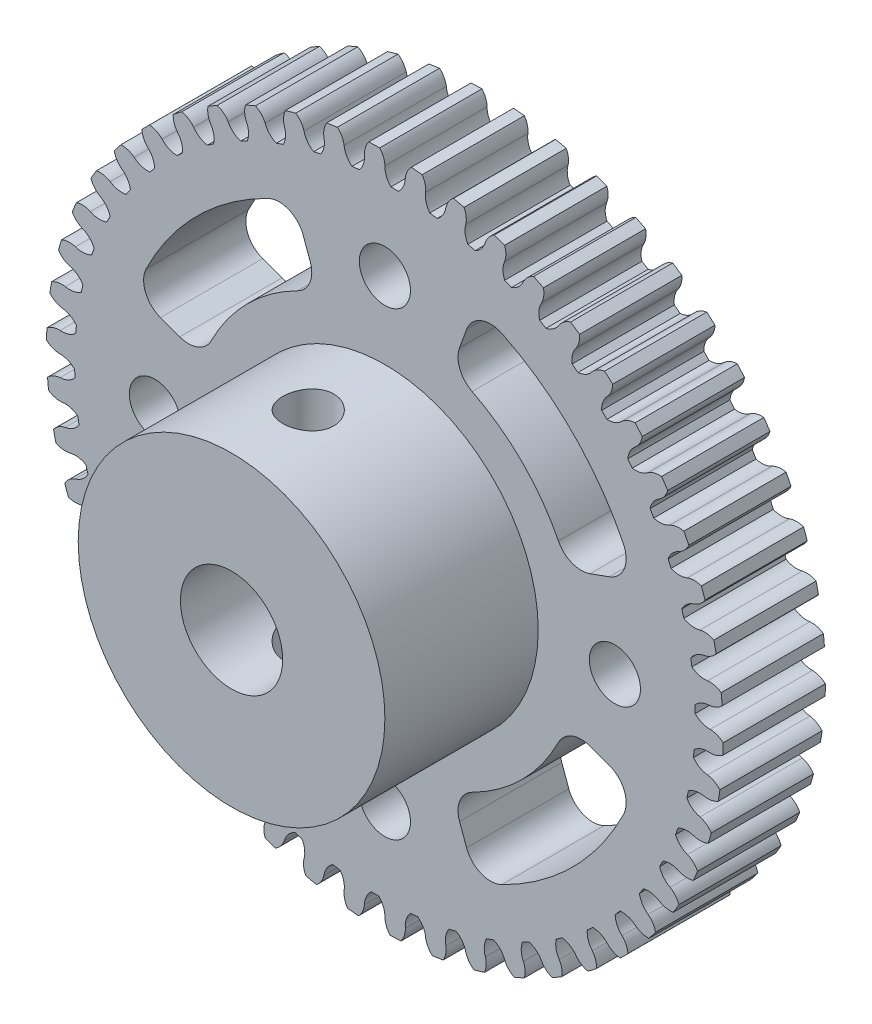
from build123d import *
from build123d.topology import SkipClean

# Parameters (mm, degrees)
SKETCH1_R               = 33.1
BOSS_EXTRUDE2_DEPTH     = 10
CUT_EXTRUDE1_START      = -18
CUT_EXTRUDE1_DEPTH      = 18
CIRPATTERN1_COUNT       = 50
SKETCH4_R               = 5
CUT_EXTRUDE2_DEPTH      = 78
SKETCH5_R               = 15
SKETCH5_R_2             = 5
BOSS_EXTRUDE3_DEPTH     = 15
SKETCH8_R               = 2.5
CUT_EXTRUDE3_DEPTH      = 40
CUT_EXTRUDE4_DEPTH      = 70
CUT_EXTRUDE4_DEPTH_BACK = 107
SKETCH11_R              = 2.5
CUT_EXTRUDE5_DEPTH      = 87


with BuildPart() as part:
    # Sketch1 → Boss-Extrude2 (new body)
    with BuildSketch(Plane.XY):
        Circle(SKETCH1_R)
    extrude(amount=BOSS_EXTRUDE2_DEPTH)

    # Sketch3 → Cut-Extrude1 (cut)
    with BuildSketch(Plane.XY.offset(10).offset(CUT_EXTRUDE1_START)):
        with BuildLine():
            ThreePointArc((1.999012735, 31.767166195), (2.182306526, 32.434344174), (2.5819624, 32.999143476))
            ThreePointArc((2.5819624, 32.999143476), (1.039899466, 33.083660757), (-0.50442729, 33.096156168))
            ThreePointArc((-0.50442729, 33.096156168), (-0.141031324, 32.507372301), (0, 31.83))
            ThreePointArc((0, 31.83), (0.141753405, 31.025150169), (0.593612137, 30.344194249))
            ThreePointArc((0.593612137, 30.344194249), (0.953502985, 30.335018247), (1.313259671, 30.321573987))
            ThreePointArc((1.313259671, 30.321573987), (1.806992344, 30.972807682), (1.999012735, 31.767166195))
        make_face()
    cut_extrude1 = extrude(amount=CUT_EXTRUDE1_DEPTH, mode=Mode.SUBTRACT)

    # CirPattern1: Cut-Extrude1 ×50 about axis
    cirpattern1_axis = Axis((0, 0, 10), (0, 0, 1))
    for i in range(1, CIRPATTERN1_COUNT):
        add(cut_extrude1.rotate(cirpattern1_axis, i * 360 / CIRPATTERN1_COUNT), mode=Mode.SUBTRACT)

    # Sketch4 → Cut-Extrude2 (cut)
    with BuildSketch(Plane(origin=(0, 0, 0), x_dir=(-1, 0, 0), z_dir=(0, 0, -1))):
        Circle(SKETCH4_R)
    extrude(amount=-CUT_EXTRUDE2_DEPTH, mode=Mode.SUBTRACT)

    # Sketch5 → Boss-Extrude3 (add)
    with SkipClean():  # the faces are left unmerged after this step: merging them gives an invalid solid
        with BuildSketch(Plane.XY.offset(10)):
            Circle(SKETCH5_R)
            Circle(SKETCH5_R_2, mode=Mode.SUBTRACT)
        extrude(amount=BOSS_EXTRUDE3_DEPTH)

    # Sketch8 → Cut-Extrude3 (cut)
    with SkipClean():  # the faces are left unmerged after this step: merging them gives an invalid solid
        with BuildSketch(Plane.XY.offset(10)):
            with Locations((-22.5, 0)):
                Circle(SKETCH8_R)
            with Locations((0, 22.5)):
                Circle(SKETCH8_R)
            with Locations((22.5, 0)):
                Circle(SKETCH8_R)
            with Locations((0, -22.5)):
                Circle(SKETCH8_R)
        extrude(amount=-CUT_EXTRUDE3_DEPTH, mode=Mode.SUBTRACT)

    # Sketch11 → Cut-Extrude4 (cut, two sides: drawn at the far end of the back side and taken through both)
    with SkipClean():  # the faces are left unmerged after this step: merging them gives an invalid solid
        with BuildSketch(Plane(origin=(0, 0, 0), x_dir=(1, 0, 0), z_dir=(0, 1, 0)).offset(-CUT_EXTRUDE4_DEPTH_BACK)):
            with Locations((0, -17.5)):
                Circle(SKETCH11_R)
        extrude(amount=CUT_EXTRUDE4_DEPTH + CUT_EXTRUDE4_DEPTH_BACK, mode=Mode.SUBTRACT)

    # Sketch13 → Cut-Extrude5 (cut)
    with SkipClean():  # the faces are left unmerged after this step: merging them gives an invalid solid
        with BuildSketch(Plane.XY.offset(10)):
            with BuildLine():
                Line((-7.303551668, 20.06634329), (-7.991862551, 21.957461897))
                ThreePointArc((-7.991862551, 21.957461897), (-9.406739424, 23.421243429), (-11.441210497, 23.347348937))
                ThreePointArc((-11.441210497, 23.347348937), (-18.384776311, 18.384776311), (-23.347348937, 11.441210497))
                ThreePointArc((-23.347348937, 11.441210497), (-23.421243429, 9.406739424), (-21.957461897, 7.991862551))
                Line((-21.957461897, 7.991862551), (-20.06634329, 7.303551668))
                ThreePointArc((-20.06634329, 7.303551668), (-18.288495296, 7.329327922), (-16.977421661, 8.530366567))
                ThreePointArc((-16.977421661, 8.530366567), (-13.435028843, 13.435028843), (-8.530366567, 16.977421661))
                ThreePointArc((-8.530366567, 16.977421661), (-7.329327922, 18.288495296), (-7.303551668, 20.06634329))
            make_face()
            with BuildLine():
                Line((20.06634329, 7.303551668), (21.957461897, 7.991862551))
                ThreePointArc((21.957461897, 7.991862551), (23.421243429, 9.406739424), (23.347348937, 11.441210497))
                ThreePointArc((23.347348937, 11.441210497), (18.384776311, 18.384776311), (11.441210497, 23.347348937))
                ThreePointArc((11.441210497, 23.347348937), (9.406739424, 23.421243429), (7.991862551, 21.957461897))
                Line((7.991862551, 21.957461897), (7.303551668, 20.06634329))
                ThreePointArc((7.303551668, 20.06634329), (7.329327922, 18.288495296), (8.530366567, 16.977421661))
                ThreePointArc((8.530366567, 16.977421661), (13.435028843, 13.435028843), (16.977421661, 8.530366567))
                ThreePointArc((16.977421661, 8.530366567), (18.288495296, 7.329327922), (20.06634329, 7.303551668))
            make_face()
            with BuildLine():
                Line((7.303551668, -20.06634329), (7.991862551, -21.957461897))
                ThreePointArc((7.991862551, -21.957461897), (9.406739424, -23.421243429), (11.441210497, -23.347348937))
                ThreePointArc((11.441210497, -23.347348937), (18.384776311, -18.384776311), (23.347348937, -11.441210497))
                ThreePointArc((23.347348937, -11.441210497), (23.421243429, -9.406739424), (21.957461897, -7.991862551))
                Line((21.957461897, -7.991862551), (20.06634329, -7.303551668))
                ThreePointArc((20.06634329, -7.303551668), (18.288495296, -7.329327922), (16.977421661, -8.530366567))
                ThreePointArc((16.977421661, -8.530366567), (13.435028843, -13.435028843), (8.530366567, -16.977421661))
                ThreePointArc((8.530366567, -16.977421661), (7.329327922, -18.288495296), (7.303551668, -20.06634329))
            make_face()
            with BuildLine():
                Line((-20.06634329, -7.303551668), (-21.957461897, -7.991862551))
                ThreePointArc((-21.957461897, -7.991862551), (-23.421243429, -9.406739424), (-23.347348937, -11.441210497))
                ThreePointArc((-23.347348937, -11.441210497), (-18.384776311, -18.384776311), (-11.441210497, -23.347348937))
                ThreePointArc((-11.441210497, -23.347348937), (-9.406739424, -23.421243429), (-7.991862551, -21.957461897))
                Line((-7.991862551, -21.957461897), (-7.303551668, -20.06634329))
                ThreePointArc((-7.303551668, -20.06634329), (-7.329327922, -18.288495296), (-8.530366567, -16.977421661))
                ThreePointArc((-8.530366567, -16.977421661), (-13.435028843, -13.435028843), (-16.977421661, -8.530366567))
                ThreePointArc((-16.977421661, -8.530366567), (-18.288495296, -7.329327922), (-20.06634329, -7.303551668))
            make_face()
        extrude(amount=-CUT_EXTRUDE5_DEPTH, mode=Mode.SUBTRACT)


solid = part.part
